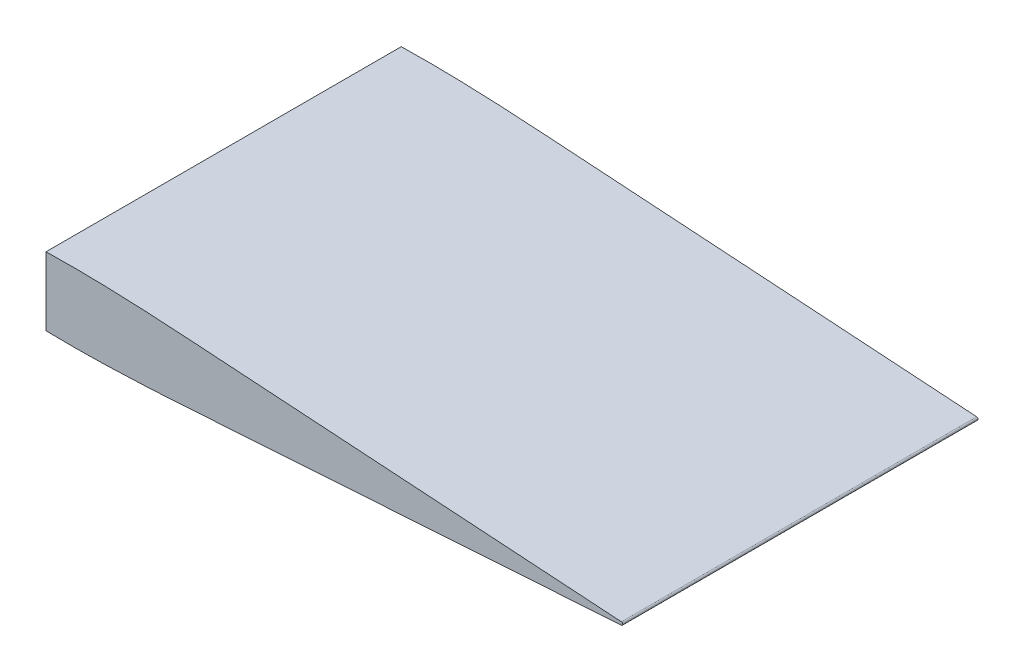
from build123d import *

# Parameters (mm, degrees)
BOSS_EXTRU_1_DEPTH             = 150
FRACTIONNER1_SURFACE_1_BACK    = 338.186
FRACTIONNER1_SURFACE_1_DEPTH   = 676.372
FRACTIONNER1_SURFACE_2_BACK    = 338.186
FRACTIONNER1_SURFACE_2_DEPTH   = 676.372
CORPS_SUPPRIMER_GARDER_1_DEPTH = 150
ESQUISSE4_W                    = 70
ESQUISSE4_H                    = 27
ENL_V_MAT_EXTRU_1_DEPTH        = 20


with BuildPart() as part:
    # Esquisse1 → Boss.-Extru.1 (new body)
    with BuildSketch(Plane.XY):
        with BuildLine():
            ThreePointArc((300, 0.615), (300.57616321, 0), (300, -0.615))
            add(Edge.make_bspline(
                [(300, 0.615), (297.904984084, 0.751757543), (292.317834147, 1.116473101), (283.239167486, 1.717548993), (272.763851073, 2.401734129), (262.289009769, 3.093148372), (251.814135815, 3.784066551), (241.337843931, 4.4686253), (230.862161266, 5.161453759), (220.385838201, 5.845538162), (209.911154414, 6.538349242), (199.435845553, 7.222650253), (188.961161962, 7.915464365), (178.484838114, 8.599536639), (168.010154067, 9.292344726), (157.534847028, 9.976669832), (147.06015641, 10.669390538), (136.583858848, 11.353812357), (126.108081003, 12.045381523), (115.628989204, 12.734847578), (106.544413863, 13.318771764), (98.151476207, 13.759261663), (91.156562369, 14.075053545), (83.459091103, 14.332671008), (76.809762769, 14.494266326), (71.208103955, 14.553043896), (68.057010771, 14.564841535), (65.955984612, 14.566136146), (63.504942858, 14.548307662), (58.950185243, 14.50722741), (52.639372933, 14.342178025), (45.976395003, 14.041169691), (40.714278866, 13.694270896), (36.853148612, 13.371585869), (33.690528003, 13.066756335), (30.525686443, 12.713592883), (27.357424626, 12.304603807), (23.829347777, 11.773145061), (20.293449043, 11.155810812), (16.752613493, 10.405038809), (13.91014568, 9.695268378), (11.411898729, 8.968942676), (9.247069544, 8.239122328), (7.047101664, 7.371563533), (5.204368253, 6.469298236), (3.704406867, 5.566960218), (2.492406306, 4.671764118), (0.823776108, 3.084389444), (-0.563560511, 0), (0.823776108, -3.084389444), (2.492406306, -4.671764118), (3.704406867, -5.566960218), (5.204368253, -6.469298236), (7.047101664, -7.371563533), (9.247069544, -8.239122328), (11.411898729, -8.968942676), (13.91014568, -9.695268378), (16.752613493, -10.405038809), (20.293449043, -11.155810812), (23.829347777, -11.773145061), (27.357424626, -12.304603807), (30.525686443, -12.713592883), (33.690528003, -13.066756335), (36.853148612, -13.371585869), (40.714278866, -13.694270896), (45.976395003, -14.041169691), (52.639372933, -14.342178025), (58.950185243, -14.50722741), (63.504942858, -14.548307662), (65.955984612, -14.566136146), (68.057010771, -14.564841535), (71.208103955, -14.553043896), (76.809762769, -14.494266326), (83.459091103, -14.332671008), (91.156562369, -14.075053545), (98.151476207, -13.759261663), (106.544413863, -13.318771764), (115.628989204, -12.734847578), (126.108081003, -12.045381523), (136.583858848, -11.353812357), (147.06015641, -10.669390538), (157.534847028, -9.976669832), (168.010154067, -9.292344726), (178.484838114, -8.599536639), (188.961161962, -7.915464365), (199.435845553, -7.222650253), (209.911154414, -6.538349242), (220.385838201, -5.845538162), (230.862161266, -5.161453759), (241.337843931, -4.4686253), (251.814135815, -3.784066551), (262.289009769, -3.093148372), (272.763851073, -2.401734129), (283.239167486, -1.717548993), (292.317834147, -1.116473101), (297.904984084, -0.751757543), (300, -0.615)],
                knots=[0, 0, 0, 0, 0.010331767, 0.027553552, 0.044775014, 0.061991889, 0.079213674, 0.096435137, 0.113656922, 0.130878384, 0.14810017, 0.165316721, 0.182538507, 0.199759969, 0.216981754, 0.234198306, 0.251420091, 0.268641554, 0.285863339, 0.303084802, 0.320322147, 0.330661097, 0.344443905, 0.354779244, 0.368562092, 0.377174559, 0.382346694, 0.384069086, 0.387513926, 0.39440881, 0.406484298, 0.418578438, 0.427229264, 0.432434172, 0.437645264, 0.442864528, 0.448104782, 0.453364927, 0.460421621, 0.465764879, 0.471174038, 0.474835156, 0.478565394, 0.482412615, 0.486466494, 0.488643966, 0.491021881, 0.493857902, 0.5, 0.506142098, 0.508978119, 0.511356034, 0.513533506, 0.517587385, 0.521434606, 0.525164844, 0.528825962, 0.534235121, 0.539578379, 0.546635073, 0.551895218, 0.557135472, 0.562354736, 0.567565828, 0.572770736, 0.581421562, 0.593515702, 0.60559119, 0.612486074, 0.615930914, 0.617653306, 0.622825441, 0.631437908, 0.645220756, 0.655556095, 0.669338903, 0.679677853, 0.696915198, 0.714136661, 0.731358446, 0.748579909, 0.765801694, 0.783018246, 0.800240031, 0.817461493, 0.834683279, 0.85189983, 0.869121616, 0.886343078, 0.903564863, 0.920786326, 0.938008111, 0.955224986, 0.972446448, 0.989668233, 1, 1, 1, 1], degree=3))
        make_face()
    extrude(amount=BOSS_EXTRU_1_DEPTH)


with BuildPart() as body_2:
    # Fractionner1: the piece behind the surface
    add(part.part)
    # Fractionner1 surface: a surface, the sketch's curves swept straight by 676.372 mm
    with BuildLine(Plane.XY.offset(150).offset(-FRACTIONNER1_SURFACE_1_BACK), mode=Mode.PRIVATE) as fractionner1_surface_1_path:
        Line((57.022091302, 21.120873497), (57.022091302, -26.585419846))
    fractionner1_surface_1 = Shell.extrude(fractionner1_surface_1_path.wire(), (0 * FRACTIONNER1_SURFACE_1_DEPTH, 0 * FRACTIONNER1_SURFACE_1_DEPTH, 1 * FRACTIONNER1_SURFACE_1_DEPTH))
    split(bisect_by=fractionner1_surface_1, keep=Keep.BOTTOM)

    # Corps-Supprimer/Garder 1: read off the stored shape, not the designer's step
    # Corps-Supprimer/Garder 1 outline → Corps-Supprimer/Garder 1 (cut)
    with BuildSketch(Plane.XY):
        with BuildLine():
            Line((57.022091311, -14.449616285), (57.022091311, 14.449616285))
            add(Edge.make_bspline(
                [(57.022091311, 14.449616285), (55.562497262, 14.414805897), (51.646493469, 14.297323458), (45.976395003, 14.041169691), (40.714278866, 13.694270896), (36.853148612, 13.371585869), (33.690528003, 13.066756335), (30.525686443, 12.713592883), (27.357424626, 12.304603807), (23.829347777, 11.773145061), (20.293449043, 11.155810812), (16.752613493, 10.405038809), (13.91014568, 9.695268378), (11.411898729, 8.968942676), (9.247069544, 8.239122328), (7.047101664, 7.371563533), (5.204368253, 6.469298236), (3.704406867, 5.566960218), (2.492406306, 4.671764118), (0.823776108, 3.084389444), (-0.563560511, 0), (0.823776108, -3.084389444), (2.492406306, -4.671764118), (3.704406867, -5.566960218), (5.204368253, -6.469298236), (7.047101664, -7.371563533), (9.247069544, -8.239122328), (11.411898729, -8.968942676), (13.91014568, -9.695268378), (16.752613493, -10.405038809), (20.293449043, -11.155810812), (23.829347777, -11.773145061), (27.357424626, -12.304603807), (30.525686443, -12.713592883), (33.690528003, -13.066756335), (36.853148612, -13.371585869), (40.714278866, -13.694270896), (45.976395003, -14.041169691), (51.646493469, -14.297323458), (55.562497262, -14.414805897), (57.022091311, -14.449616285)],
                knots=[0.399299529, 0.399299529, 0.399299529, 0.399299529, 0.406484298, 0.418578438, 0.427229264, 0.432434172, 0.437645264, 0.442864528, 0.448104782, 0.453364927, 0.460421621, 0.465764879, 0.471174038, 0.474835156, 0.478565394, 0.482412615, 0.486466494, 0.488643966, 0.491021881, 0.493857902, 0.5, 0.506142098, 0.508978119, 0.511356034, 0.513533506, 0.517587385, 0.521434606, 0.525164844, 0.528825962, 0.534235121, 0.539578379, 0.546635073, 0.551895218, 0.557135472, 0.562354736, 0.567565828, 0.572770736, 0.581421562, 0.593515702, 0.600700471, 0.600700471, 0.600700471, 0.600700471], degree=3))
        make_face()
    extrude(amount=CORPS_SUPPRIMER_GARDER_1_DEPTH, mode=Mode.SUBTRACT)


with BuildPart() as part_1:
    add(part.part)

    # Fractionner1: split by a surface, the side it looks to stays
    # Fractionner1 surface: a surface, the sketch's curves swept straight by 676.372 mm
    with BuildLine(Plane.XY.offset(150).offset(-FRACTIONNER1_SURFACE_2_BACK), mode=Mode.PRIVATE) as fractionner1_surface_2_path:
        Line((57.022091302, 21.120873497), (57.022091302, -26.585419846))
    fractionner1_surface_2 = Shell.extrude(fractionner1_surface_2_path.wire(), (0 * FRACTIONNER1_SURFACE_2_DEPTH, 0 * FRACTIONNER1_SURFACE_2_DEPTH, 1 * FRACTIONNER1_SURFACE_2_DEPTH))
    split(bisect_by=fractionner1_surface_2, keep=Keep.TOP)

    # Esquisse4 → Enlèv. mat.-Extru.1 (cut)
    with BuildSketch(Plane.ZY.offset(-57.022091302)):
        with Locations((75, 0.035962925)):
            Rectangle(ESQUISSE4_W, ESQUISSE4_H)
    extrude(amount=-ENL_V_MAT_EXTRU_1_DEPTH, mode=Mode.SUBTRACT)


solid = part_1.part
